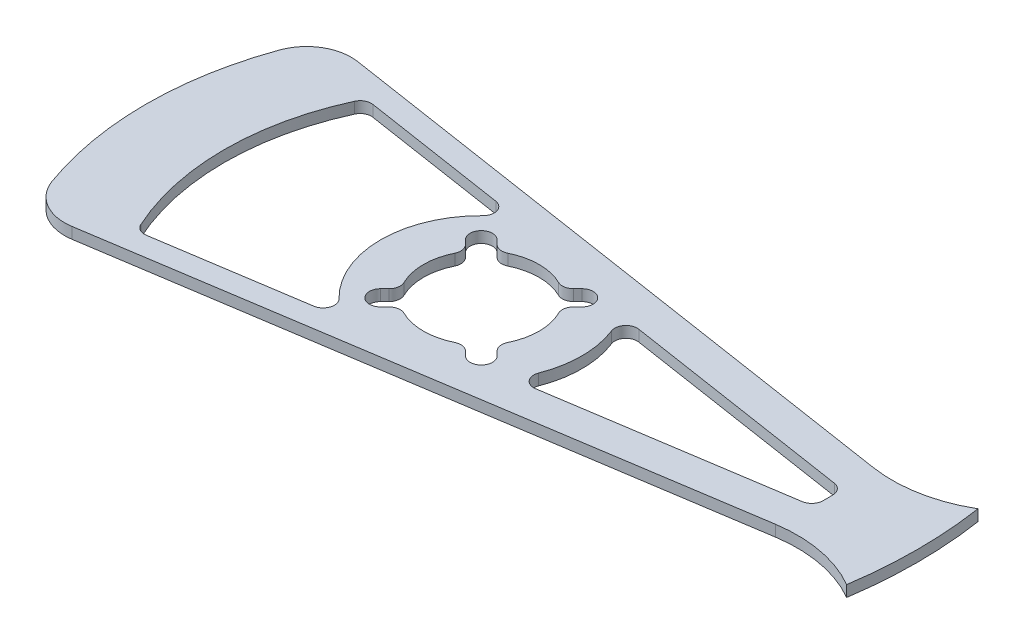
from build123d import *

# Parameters (mm, degrees)
BOSS_EXTRUDE1_DEPTH = 6.35
FILLET1_R           = 6.35
FILLET2_R           = 25.4
FILLET3_R           = 6.35


with BuildPart() as part:
    # Sketch1 → Boss-Extrude1 (new body)
    with BuildSketch(Plane(origin=(0, 0, 0), x_dir=(1, 0, 0), z_dir=(0, 1, 0))):
        with BuildLine():
            Line((194.872934042, 27.82915877), (-170.916556976, 84.129546246))
            ThreePointArc((-170.916556976, 84.129546246), (-190.5, 0), (-170.916556976, -84.129546246))
            Line((-170.916556976, -84.129546246), (194.872934042, -27.82915877))
            ThreePointArc((194.872934042, -27.82915877), (220.662117475, -28.27659702), (244.824613145, -37.301894031))
            ThreePointArc((244.824613145, -37.301894031), (247.65, 0), (244.824613145, 37.301894031))
            ThreePointArc((244.824613145, 37.301894031), (220.662117475, 28.27659702), (194.872934042, 27.82915877))
        make_face()
        with BuildLine():
            ThreePointArc((-130.60870167, -65.076024595), (-145.923, 0), (-130.60870167, 65.076024595))
            Line((-130.60870167, 65.076024595), (-28.741073501, 49.39709702))
            ThreePointArc((-28.741073501, 49.39709702), (-57.15, 0), (-28.741073501, -49.39709702))
            Line((-28.741073501, -49.39709702), (-130.60870167, -65.076024595))
        make_face(mode=Mode.SUBTRACT)
        with BuildLine():
            ThreePointArc((47.897230141, -31.17655922), (57.15, 0), (47.897230141, 31.17655922))
            Line((47.897230141, 31.17655922), (196.675896516, 8.277332285))
            ThreePointArc((196.675896516, 8.277332285), (196.85, 0), (196.675896516, -8.277332285))
            Line((196.675896516, -8.277332285), (47.897230141, -31.17655922))
        make_face(mode=Mode.SUBTRACT)
        with BuildLine():
            Line((-27.26570237, 18.285446249), (-33.065128061, 24.084871939))
            ThreePointArc((-33.065128061, 24.084871939), (-33.065128061, 33.065128061), (-24.084871939, 33.065128061))
            Line((-24.084871939, 33.065128061), (-18.285446249, 27.26570237))
            ThreePointArc((-18.285446249, 27.26570237), (0, 32.8295), (18.285446249, 27.26570237))
            Line((18.285446249, 27.26570237), (24.084871939, 33.065128061))
            ThreePointArc((24.084871939, 33.065128061), (31.005039796, 34.441635031), (34.925, 28.575))
            ThreePointArc((34.925, 28.575), (34.441635031, 26.144960204), (33.065128061, 24.084871939))
            Line((33.065128061, 24.084871939), (27.26570237, 18.285446249))
            ThreePointArc((27.26570237, 18.285446249), (31.407765331, 9.556586585), (32.8295, 0))
            ThreePointArc((32.8295, 0), (31.407765331, -9.556586585), (27.26570237, -18.285446249))
            Line((27.26570237, -18.285446249), (33.065128061, -24.084871939))
            ThreePointArc((33.065128061, -24.084871939), (34.441635031, -26.144960204), (34.925, -28.575))
            ThreePointArc((34.925, -28.575), (31.005039796, -34.441635031), (24.084871939, -33.065128061))
            Line((24.084871939, -33.065128061), (18.285446249, -27.26570237))
            ThreePointArc((18.285446249, -27.26570237), (0, -32.8295), (-18.285446249, -27.26570237))
            Line((-18.285446249, -27.26570237), (-24.084871939, -33.065128061))
            ThreePointArc((-24.084871939, -33.065128061), (-33.065128061, -33.065128061), (-33.065128061, -24.084871939))
            Line((-33.065128061, -24.084871939), (-27.26570237, -18.285446249))
            ThreePointArc((-27.26570237, -18.285446249), (-32.8295, 0), (-27.26570237, 18.285446249))
        make_face(mode=Mode.SUBTRACT)
    extrude(amount=BOSS_EXTRUDE1_DEPTH)

    # Fillet1
    fillet1_edges = [part.edges().sort_by_distance(p)[0] for p in [
        (47.897230141, 3.175, 31.17655922),
        (47.897230141, 3.175, -31.17655922),
        (196.675896516, 3.175, -8.277332285),
        (196.675896516, 3.175, 8.277332285),
        (-130.60870167, 3.175, -65.076024595),
        (-130.60870167, 3.175, 65.076024595),
        (-28.741073501, 3.175, -49.39709702),
        (-28.741073501, 3.175, 49.39709702),
    ]]
    fillet(fillet1_edges, radius=FILLET1_R)

    # Fillet2
    fillet2_edges = [part.edges().sort_by_distance(p)[0] for p in [
        (-170.916556976, 3.175, -84.129546246),
        (-170.916556976, 3.175, 84.129546246),
    ]]
    fillet(fillet2_edges, radius=FILLET2_R)

    # Fillet3
    fillet3_edges = [part.edges().sort_by_distance(p)[0] for p in [
        (-18.285446249, 3.175, 27.26570237),
        (18.285446249, 3.175, 27.26570237),
        (27.26570237, 3.175, 18.285446249),
        (27.26570237, 3.175, -18.285446249),
        (-18.285446249, 3.175, -27.26570237),
        (18.285446249, 3.175, -27.26570237),
        (-27.26570237, 3.175, -18.285446249),
        (-27.26570237, 3.175, 18.285446249),
    ]]
    fillet(fillet3_edges, radius=FILLET3_R)


solid = part.part
